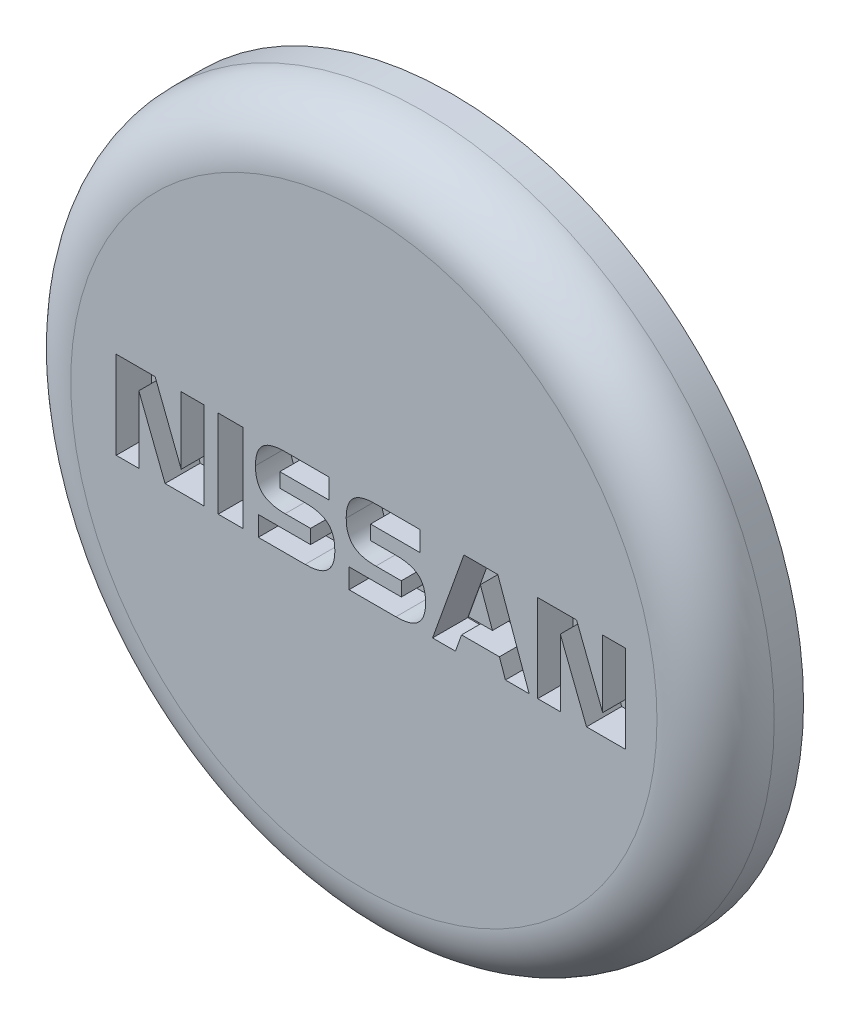
from build123d import *

# Parameters (mm, degrees)
SKETCH_1_R          = 6
EXTRUDE_1_DEPTH     = 1.5
SKETCH_2_R          = 0.75
EXTRUDE_2_DEPTH     = 2.5
FILLET_1_R          = 1
SKETCH_3_W          = 0.424558316
SKETCH_3_H          = 1.494013889
CUT_EXTRUDE_1_DEPTH = 0.6
SKETCH_4_R          = 1
EXTRUDE_3_DEPTH     = 1.5
CHAMFER_4_SIZE      = 0.6
CHAMFER_4_SIZE2     = 0.767964979
FILLET_3_R          = 0.2
CHAMFER_5_SIZE      = 0.2
CHAMFER_5_SIZE2     = 0.559517619
SKETCH_5_W          = 0.8
SKETCH_5_H          = 3.285085656
CUT_EXTRUDE_2_DEPTH = 2.7
CUT_EXTRUDE_2_DRAFT = -6


with BuildPart() as part:
    # Эскиз1 → Бобышка-Вытянуть1 (new body)
    with BuildSketch(Plane.XY):
        Circle(SKETCH_1_R)
    extrude(amount=EXTRUDE_1_DEPTH)

    # Эскиз2 → Бобышка-Вытянуть2 (add)
    with BuildSketch(Plane(origin=(0, 0, 0), x_dir=(-1, 0, 0), z_dir=(0, 0, -1))):
        with Locations(Location((0, 0, 0), (0, 0, 180))):
            Circle(SKETCH_2_R)
    extrude(amount=EXTRUDE_2_DEPTH)

    # Скругление1
    fillet_1_edges = [part.edges().sort_by_distance(p)[0] for p in [
        (-6, 0, 1.5),
    ]]
    fillet(fillet_1_edges, radius=FILLET_1_R)

    # Эскиз3 → Вырез-Вытянуть1 (cut)
    # profile 1 of 6: a face of its own
    with BuildSketch(Plane.XY.offset(1.5)):
        Polygon((-2.729214443, 0.790336415), (-3.1148894, 0.790336415), (-3.1148894, -0.356034881), (-3.559883402, 0.790336415), (-4.223228594, 0.790336415), (-4.223228594, -0.703677474), (-3.837529233, -0.703677474), (-3.837529233, 0.442723736), (-3.390633547, -0.703677474), (-2.729214443, -0.703677474), align=None)
    # profile 2 of 6: a face of its own
    with BuildSketch(Plane.XY.offset(1.5)):
        with Locations((-2.272411081, 0.043329471)):
            Rectangle(SKETCH_3_W, SKETCH_3_H)
    # profile 3 of 6: a face of its own
    with BuildSketch(Plane.XY.offset(1.5)):
        with BuildLine():
            add(Edge.make_bspline(
                [(-1.000965963, -0.703677474), (-0.979698888, -0.703436149), (-0.938550633, -0.702969224), (-0.879005769, -0.697462513), (-0.823842071, -0.688764798), (-0.773033047, -0.676601053), (-0.726803607, -0.660385287), (-0.684814597, -0.640915747), (-0.647433046, -0.61742683), (-0.614563918, -0.590236648), (-0.585724429, -0.559629714), (-0.561151686, -0.525099977), (-0.540366674, -0.486921184), (-0.523530585, -0.445044417), (-0.51026032, -0.39961327), (-0.501389597, -0.350438912), (-0.495842524, -0.297700311), (-0.495581689, -0.261309939), (-0.495447404, -0.242575184)],
                knots=[0, 0, 0, 0, 1.292483776, 2.500741325, 3.631331596, 4.685184439, 5.671927933, 6.604816413, 7.493082337, 8.34780506, 9.191425202, 10.04213214, 10.9168945, 11.827915869, 12.780786922, 13.788916813, 14.861674104, 16, 16, 16, 16], degree=3))
            add(Edge.make_bspline(
                [(-0.495447404, -0.242575184), (-0.495580181, -0.223750989), (-0.495837493, -0.187271317), (-0.501366872, -0.134527799), (-0.510240943, -0.085619714), (-0.523423115, -0.040768405), (-0.540390783, 0.000175153), (-0.561082539, 0.037267029), (-0.585781218, 0.070474347), (-0.614525713, 0.099774387), (-0.647602907, 0.125274882), (-0.684875429, 0.147474071), (-0.726925044, 0.165500853), (-0.773114678, 0.180664501), (-0.823900518, 0.191959607), (-0.879007717, 0.200327919), (-0.938652032, 0.204735839), (-0.979831107, 0.205147341), (-1.00115516, 0.205360433)],
                knots=[0, 0, 0, 0, 1.154388575, 2.23710581, 3.249194044, 4.200365525, 5.099519039, 5.96317456, 6.799597264, 7.631222006, 8.47325859, 9.355423982, 10.285598407, 11.274442818, 12.334282718, 13.473674749, 14.691775028, 16, 16, 16, 16], degree=3))
            Line((-1.00115516, 0.205360433), (-1.433151218, 0.205628878))
            Line((-1.433151218, 0.205628878), (-1.433151218, 0.450358286))
            Line((-1.433151218, 0.450358286), (-0.592014732, 0.450358286))
            Line((-0.592014732, 0.450358286), (-0.592014732, 0.790336415))
            Line((-0.592014732, 0.790336415), (-1.34258284, 0.790336415))
            add(Edge.make_bspline(
                [(-1.34258284, 0.790336415), (-1.36394468, 0.789960988), (-1.405176131, 0.789236359), (-1.464812852, 0.784109098), (-1.52003772, 0.775802523), (-1.570689771, 0.763360824), (-1.617075747, 0.747935661), (-1.659012736, 0.728643113), (-1.696296888, 0.705411632), (-1.729346705, 0.678799484), (-1.75810993, 0.648440727), (-1.782695695, 0.614060593), (-1.803849558, 0.576134127), (-1.820261555, 0.533970413), (-1.833595159, 0.488429025), (-1.842457037, 0.438975174), (-1.847947428, 0.385789644), (-1.848416458, 0.349044031), (-1.84865902, 0.330040772)],
                knots=[0, 0, 0, 0, 1.297373862, 2.504119837, 3.632891282, 4.685842781, 5.668193535, 6.597979155, 7.482596002, 8.329697744, 9.168636786, 10.014199804, 10.890834478, 11.799042165, 12.756322161, 13.76893811, 14.846190246, 16, 16, 16, 16], degree=3))
            add(Edge.make_bspline(
                [(-1.84865902, 0.330040772), (-1.848416703, 0.311126936), (-1.847948218, 0.274559755), (-1.842456795, 0.221642894), (-1.833600397, 0.172452629), (-1.820247824, 0.127190088), (-1.803928002, 0.085325786), (-1.782594068, 0.047866852), (-1.758208215, 0.013769512), (-1.729213803, -0.015997863), (-1.696453193, -0.042467147), (-1.658823726, -0.064707009), (-1.617034236, -0.083796359), (-1.570727788, -0.099312678), (-1.520019424, -0.111411827), (-1.464790184, -0.119371577), (-1.405215931, -0.124670544), (-1.364012623, -0.125163477), (-1.342682556, -0.125418658)],
                knots=[0, 0, 0, 0, 1.153181597, 2.229510795, 3.240997407, 4.197041188, 5.103982821, 5.974744548, 6.81942645, 7.653977562, 8.501199656, 9.380963505, 10.312355212, 11.29882056, 12.354897282, 13.487566895, 14.699367347, 16, 16, 16, 16], degree=3))
            Line((-1.342682556, -0.125418658), (-0.908564914, -0.125259375))
            Line((-0.908564914, -0.125259375), (-0.908564914, -0.365534115))
            Line((-0.908564914, -0.365534115), (-1.799977017, -0.365534115))
            Line((-1.799977017, -0.365534115), (-1.799977017, -0.703677474))
            Line((-1.799977017, -0.703677474), (-1.000965963, -0.703677474))
        make_face()
    # profile 4 of 6: a face of its own
    with BuildSketch(Plane.XY.offset(1.5)):
        with BuildLine():
            add(Edge.make_bspline(
                [(0.546789977, -0.703677474), (0.568057051, -0.703436149), (0.609205307, -0.702969224), (0.66875017, -0.697462513), (0.723913868, -0.688764798), (0.774722892, -0.676601053), (0.820952332, -0.660385287), (0.862941342, -0.640915747), (0.900322893, -0.61742683), (0.933192021, -0.590236648), (0.96203151, -0.559629714), (0.986604254, -0.525099977), (1.007389265, -0.486921184), (1.024225354, -0.445044417), (1.037495619, -0.39961327), (1.046366343, -0.350438912), (1.051913415, -0.297700311), (1.052174251, -0.261309939), (1.052308536, -0.242575184)],
                knots=[0, 0, 0, 0, 1.292483776, 2.500741325, 3.631331596, 4.685184439, 5.671927933, 6.604816413, 7.493082337, 8.34780506, 9.191425202, 10.04213214, 10.9168945, 11.827915869, 12.780786922, 13.788916813, 14.861674104, 16, 16, 16, 16], degree=3))
            add(Edge.make_bspline(
                [(1.052308536, -0.242575184), (1.052175758, -0.223750989), (1.051918446, -0.187271317), (1.046389067, -0.134527799), (1.037514996, -0.085619714), (1.024332824, -0.040768405), (1.007365157, 0.000175153), (0.986673401, 0.037267029), (0.961974721, 0.070474347), (0.933230227, 0.099774387), (0.900153032, 0.125274882), (0.862880511, 0.147474071), (0.820830896, 0.165500853), (0.774641262, 0.180664501), (0.723855422, 0.191959607), (0.668748223, 0.200327919), (0.609103908, 0.204735839), (0.567924833, 0.205147341), (0.546600779, 0.205360433)],
                knots=[0, 0, 0, 0, 1.154388575, 2.23710581, 3.249194044, 4.200365525, 5.099519039, 5.96317456, 6.799597264, 7.631222006, 8.47325859, 9.355423982, 10.285598407, 11.274442818, 12.334282718, 13.473674749, 14.691775028, 16, 16, 16, 16], degree=3))
            Line((0.546600779, 0.205360433), (0.114604721, 0.205628878))
            Line((0.114604721, 0.205628878), (0.114604721, 0.450358286))
            Line((0.114604721, 0.450358286), (0.955741207, 0.450358286))
            Line((0.955741207, 0.450358286), (0.955741207, 0.790336415))
            Line((0.955741207, 0.790336415), (0.205173099, 0.790336415))
            add(Edge.make_bspline(
                [(0.205173099, 0.790336415), (0.18381126, 0.789960988), (0.142579809, 0.789236359), (0.082943087, 0.784109098), (0.02771822, 0.775802523), (-0.022933831, 0.763360824), (-0.069319808, 0.747935661), (-0.111256796, 0.728643113), (-0.148540948, 0.705411632), (-0.181590766, 0.678799484), (-0.210353991, 0.648440727), (-0.234939756, 0.614060593), (-0.256093619, 0.576134127), (-0.272505616, 0.533970413), (-0.28583922, 0.488429025), (-0.294701098, 0.438975174), (-0.300191489, 0.385789644), (-0.300660518, 0.349044031), (-0.300903081, 0.330040772)],
                knots=[0, 0, 0, 0, 1.297373862, 2.504119837, 3.632891282, 4.685842781, 5.668193535, 6.597979155, 7.482596002, 8.329697744, 9.168636786, 10.014199804, 10.890834478, 11.799042165, 12.756322161, 13.76893811, 14.846190246, 16, 16, 16, 16], degree=3))
            add(Edge.make_bspline(
                [(-0.300903081, 0.330040772), (-0.300660764, 0.311126936), (-0.300192278, 0.274559755), (-0.294700856, 0.221642894), (-0.285844458, 0.172452629), (-0.272491885, 0.127190088), (-0.256172063, 0.085325786), (-0.234838128, 0.047866852), (-0.210452276, 0.013769512), (-0.181457863, -0.015997863), (-0.148697254, -0.042467147), (-0.111067787, -0.064707009), (-0.069278296, -0.083796359), (-0.022971849, -0.099312678), (0.027736515, -0.111411827), (0.082965755, -0.119371577), (0.142540008, -0.124670544), (0.183743316, -0.125163477), (0.205073384, -0.125418658)],
                knots=[0, 0, 0, 0, 1.153181597, 2.229510795, 3.240997407, 4.197041188, 5.103982821, 5.974744548, 6.81942645, 7.653977562, 8.501199656, 9.380963505, 10.312355212, 11.29882056, 12.354897282, 13.487566895, 14.699367347, 16, 16, 16, 16], degree=3))
            Line((0.205073384, -0.125418658), (0.639191025, -0.125259375))
            Line((0.639191025, -0.125259375), (0.639191025, -0.365534115))
            Line((0.639191025, -0.365534115), (-0.252221078, -0.365534115))
            Line((-0.252221078, -0.365534115), (-0.252221078, -0.703677474))
            Line((-0.252221078, -0.703677474), (0.546789977, -0.703677474))
        make_face()
    # profile 5 of 6: a face of its own
    with BuildSketch(Plane.XY.offset(1.5)):
        Polygon((2.819388155, -0.703677474), (2.284475238, 0.790336415), (1.706843581, 0.790336415), (1.171930664, -0.703677474), (1.561971333, -0.703677474), (1.665982178, -0.411323837), (2.312335286, -0.411323837), (2.414488794, -0.703677474), align=None)
        Polygon((2.193465749, -0.083011136), (1.782994378, -0.083011136), (1.987301395, 0.490743678), align=None, mode=Mode.SUBTRACT)
    # profile 6 of 6: a face of its own
    with BuildSketch(Plane.XY.offset(1.5)):
        Polygon((4.459252031, 0.790336415), (4.073577074, 0.790336415), (4.073577074, -0.356034881), (3.628583072, 0.790336415), (2.96523788, 0.790336415), (2.96523788, -0.703677474), (3.350937241, -0.703677474), (3.350937241, 0.442723736), (3.797832927, -0.703677474), (4.459252031, -0.703677474), align=None)
    extrude(amount=-CUT_EXTRUDE_1_DEPTH, mode=Mode.SUBTRACT)

    # Эскиз4 → Бобышка-Вытянуть3 (add)
    with BuildSketch(Plane(origin=(0, 0, -2.5), x_dir=(-1, 0, 0), z_dir=(0, 0, -1))):
        Circle(SKETCH_4_R)
    extrude(amount=EXTRUDE_3_DEPTH)

    # Фаска4
    chamfer_4_edges = [part.edges().sort_by_distance(p)[0] for p in [
        (1, 0, -4),
    ]]
    chamfer_4_side = [part.faces().sort_by_distance(p)[0] for p in [
        (1, 0, -3.25),
    ]]
    chamfer(chamfer_4_edges, length=CHAMFER_4_SIZE, length2=CHAMFER_4_SIZE2, reference=chamfer_4_side[0])

    # Скругление3
    fillet_3_edges = [part.edges().sort_by_distance(p)[0] for p in [
        (-0.75, 0, 0),
    ]]
    fillet(fillet_3_edges, radius=FILLET_3_R)

    # Фаска5
    chamfer_5_edges = [part.edges().sort_by_distance(p)[0] for p in [
        (1, 0, -3.4),
    ]]
    chamfer_5_side = [part.faces().sort_by_distance(p)[0] for p in [
        (0.61601751, 0, -3.7),
    ]]
    chamfer(chamfer_5_edges, length=CHAMFER_5_SIZE, length2=CHAMFER_5_SIZE2, reference=chamfer_5_side[0])

    # Фаска6: read off the stored shape, not the designer's step
    # Фаска6 outline → Фаска6 (revolve, cut)
    with BuildSketch(Plane.XZ):
        Polygon((0.931507342, -3.137156679), (0.68436299, -3.646602659), (0.931507342, -3.646602659), align=None)
    revolve(axis=Axis((0, 0, 0), (0, 0, 1)), mode=Mode.SUBTRACT)


with BuildPart() as cut_extrude_2_tool:
    # Эскиз5 → Вырез-Вытянуть2 (with draft: the straight prism first)
    with BuildSketch(Plane(origin=(0, 0, -4), x_dir=(-1, 0, 0), z_dir=(0, 0, -1))):
        Rectangle(SKETCH_5_W, SKETCH_5_H)
    extrude(amount=-CUT_EXTRUDE_2_DEPTH)
    # Вырез-Вытянуть2: the draft: its side faces are tilted about the plane it starts from
    cut_extrude_2_sides = [cut_extrude_2_tool.faces().sort_by_distance(p)[0] for p in [
        (0.4, 0, -2.65),
        (0, -1.642542828, -2.65),
        (-0.4, 0, -2.65),
        (0, 1.642542828, -2.65),
    ]]
    draft(cut_extrude_2_sides, Plane(origin=(0, 0, -4), x_dir=(-1, 0, 0), z_dir=(0, 0, -1)), CUT_EXTRUDE_2_DRAFT)


with BuildPart() as part_1:
    add(part.part)

    # Вырез-Вытянуть2: cut by cut_extrude_2_tool
    add(cut_extrude_2_tool.part, mode=Mode.SUBTRACT)


solid = part_1.part
